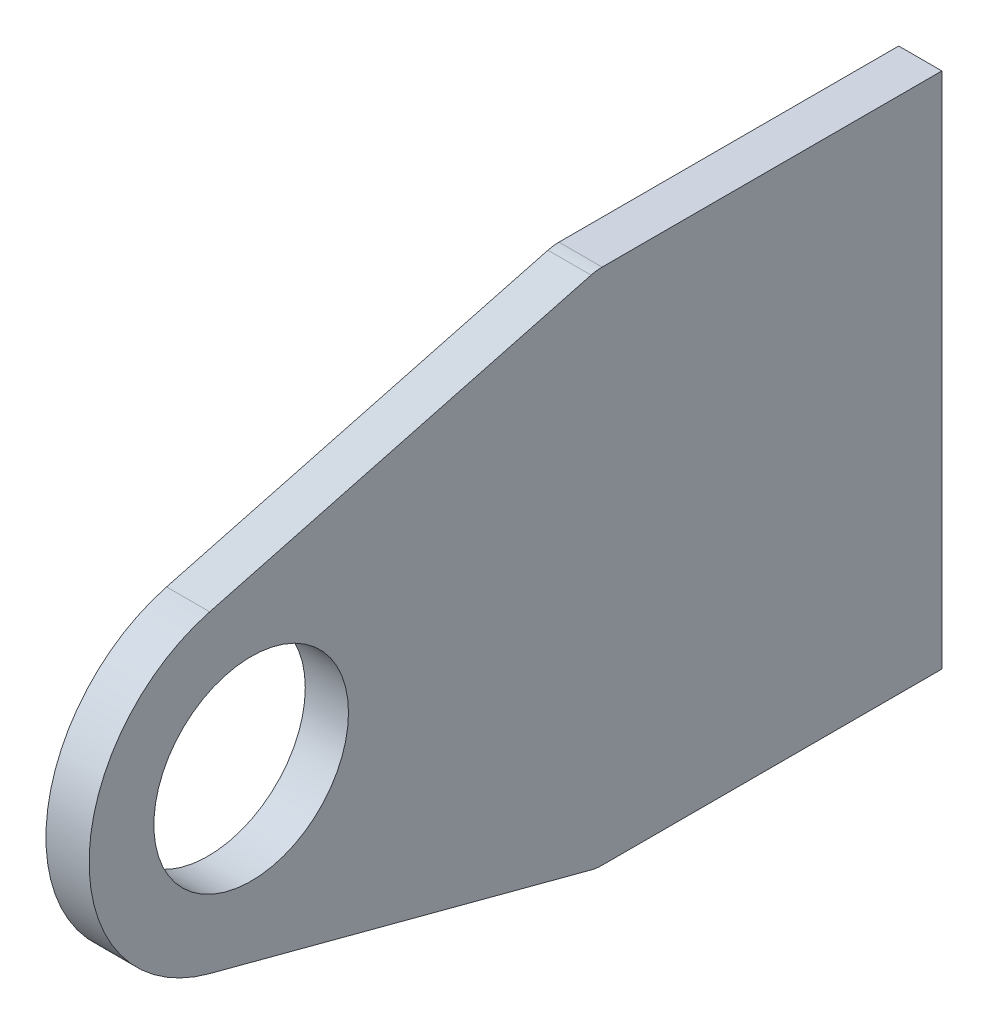
from build123d import *

# Parameters (mm, degrees)
SKETCH1_R           = 14.3129
BOSS_EXTRUDE1_DEPTH = 6.35
FILLET1_R           = 6.35


with BuildPart() as part:
    # Sketch1 → Boss-Extrude1 (new body)
    with BuildSketch(Plane(origin=(0, 0, 0), x_dir=(0, 0, -1), z_dir=(1, 0, 0))):
        with BuildLine():
            Line((0, -38.1), (0, 38.1))
            Line((0, 38.1), (-50.8, 38.1))
            Line((-50.8, 38.1), (-107.697680982, 23.044820742))
            ThreePointArc((-107.697680982, 23.044820742), (-125.4379, 0), (-107.697680982, -23.044820742))
            Line((-107.697680982, -23.044820742), (-50.8, -38.1))
            Line((-50.8, -38.1), (0, -38.1))
        make_face()
        with Locations((-101.6, 0)):
            Circle(SKETCH1_R, mode=Mode.SUBTRACT)
    extrude(amount=BOSS_EXTRUDE1_DEPTH)

    # Fillet1
    fillet1_edges = [part.edges().sort_by_distance(p)[0] for p in [
        (3.175, -38.1, 50.8),
        (3.175, 38.1, 50.8),
    ]]
    fillet(fillet1_edges, radius=FILLET1_R)


solid = part.part
